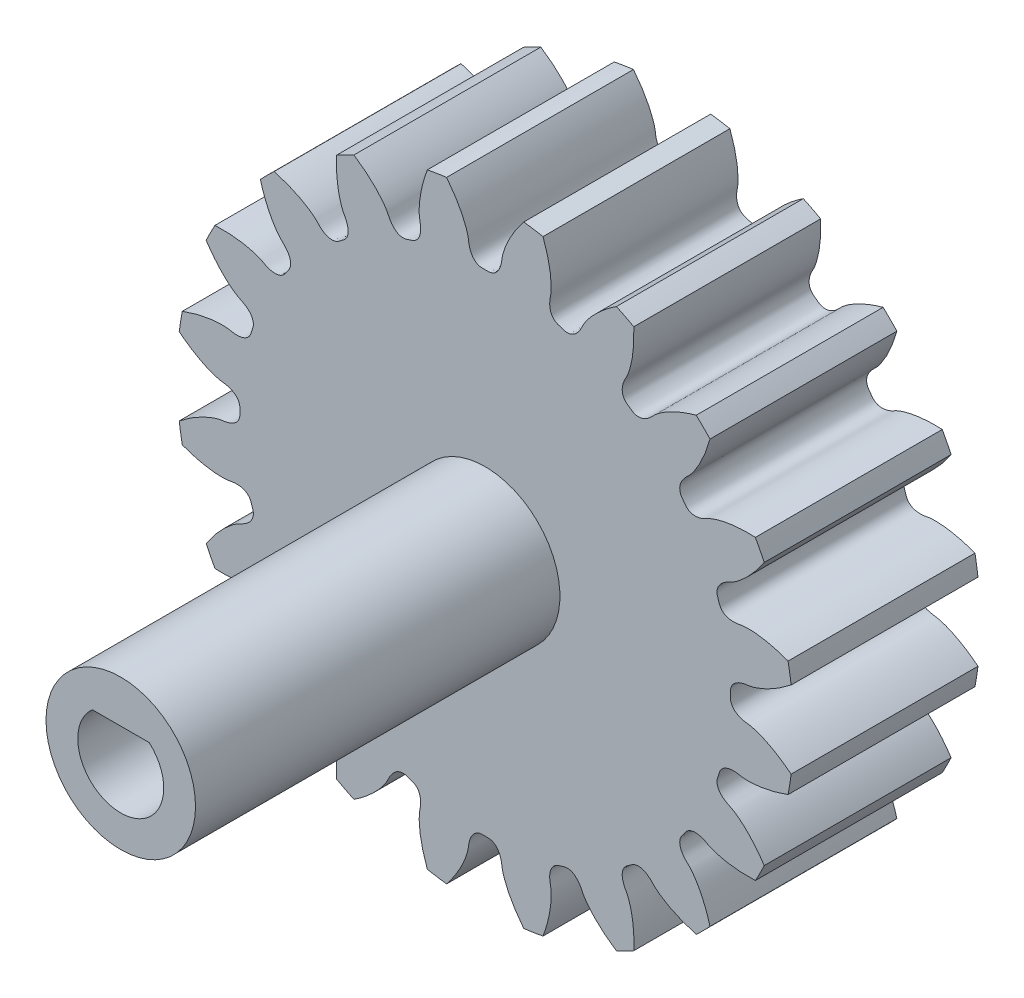
from build123d import *

# Parameters (mm, degrees)
SKETCHREVOLVESPURASSEMBLY01PINION_W       = 10
SKETCHREVOLVESPURASSEMBLY01PINION_H       = 16.499999752
TOOTHEXTRUDECUTSPURASSEMBLY01PINION_DEPTH = 5
PATTERNSPURASSEMBLY01PINION_COUNT         = 20
SKETCH1_R                                 = 4
BOSS_EXTRUDE1_DEPTH                       = 19.5
CUT_EXTRUDE5_DEPTH                        = 8
BOSS_EXTRUDE5_START                       = 5
SKETCH8_R                                 = 4
BOSS_EXTRUDE5_DEPTH                       = 5


with BuildPart() as part:
    # SketchRevolveSpurAssembly01Pinion → SpurAssembly01Pinion (revolve)
    with BuildSketch(Plane(origin=(0, 0, 0), x_dir=(0, 0, -1), z_dir=(1, 0, 0))):
        with Locations((0, 8.249999876)):
            Rectangle(SKETCHREVOLVESPURASSEMBLY01PINION_W, SKETCHREVOLVESPURASSEMBLY01PINION_H)
    revolve(axis=Axis((0, 0, 0), (0, 0, -1)))

    # SketchToothSpurAssembly01Pinion → ToothExtrudeCutSpurAssembly01Pinion (cut, symmetric)
    with BuildSketch(Plane.XY):
        with BuildLine():
            ThreePointArc((16.438815928, 2.120364973), (16.574999751, 0), (16.438815928, -2.120364973))
            add(Edge.make_bspline(
                [(16.438815928, -2.120364973), (16.306213447, -2.012632117), (16.10792267, -1.860929635), (15.841705586, -1.676668952), (15.654853966, -1.55570694), (15.475899367, -1.447553762), (15.305444286, -1.351598726), (15.144060802, -1.267206194), (14.992289617, -1.193717223), (14.850639167, -1.130450865), (14.719584807, -1.0767054), (14.599567969, -1.031760257), (14.490995634, -0.99487577), (14.394239041, -0.965299916), (14.309634999, -0.942253529), (14.237479548, -0.924980687), (14.178044201, -0.912608864), (14.049223501, -0.890261122), (13.912281496, -0.878231728), (13.769652297, -0.842658369), (13.695599357, -0.820644128), (13.624377747, -0.794966749), (13.555692175, -0.765356143), (13.489258635, -0.731124882), (13.424830796, -0.691333031), (13.362331646, -0.644635632), (13.30209452, -0.589245233), (13.24524803, -0.523019137), (13.194309632, -0.443877425), (13.153279262, -0.350864326), (13.130262908, -0.253354669), (13.120821868, -0.134969136), (13.12767395, 0), (13.120821868, 0.134969136), (13.130262908, 0.253354669), (13.153279262, 0.350864326), (13.194309632, 0.443877425), (13.24524803, 0.523019137), (13.30209452, 0.589245233), (13.362331646, 0.644635632), (13.424830796, 0.691333031), (13.489258635, 0.731124882), (13.555692175, 0.765356143), (13.624377747, 0.794966749), (13.695599357, 0.820644128), (13.769652297, 0.842658369), (13.912281496, 0.878231728), (14.049223501, 0.890261122), (14.178044201, 0.912608864), (14.237479548, 0.924980687), (14.309634999, 0.942253529), (14.394239041, 0.965299916), (14.490995634, 0.99487577), (14.599567969, 1.031760257), (14.719584807, 1.0767054), (14.850639167, 1.130450865), (14.992289617, 1.193717223), (15.144060802, 1.267206194), (15.305444286, 1.351598726), (15.475899367, 1.447553762), (15.654853966, 1.55570694), (15.841705586, 1.676668952), (16.10792267, 1.860929635), (16.306213447, 2.012632117), (16.438815928, 2.120364973)],
                knots=[0, 0, 0, 0, 0.061422842, 0.089709677, 0.116380121, 0.141434175, 0.164871838, 0.186693111, 0.206897994, 0.225486485, 0.242458587, 0.257814298, 0.271553618, 0.283676548, 0.294183087, 0.303073236, 0.310346995, 0.316004363, 0.350076802, 0.359567688, 0.36880314, 0.37784437, 0.386769007, 0.395675631, 0.404688756, 0.413962948, 0.423682731, 0.434051196, 0.445255861, 0.457401439, 0.47041984, 0.481066796, 0.5, 0.518933204, 0.52958016, 0.542598561, 0.554744139, 0.565948804, 0.576317269, 0.586037052, 0.595311244, 0.604324369, 0.613230993, 0.62215563, 0.63119686, 0.640432312, 0.649923198, 0.683995637, 0.689653005, 0.696926764, 0.705816913, 0.716323452, 0.728446382, 0.742185702, 0.757541413, 0.774513515, 0.793102006, 0.813306889, 0.835128162, 0.858565825, 0.883619879, 0.910290323, 0.938577158, 1, 1, 1, 1], degree=3))
        make_face()
    toothextrudecutspurassembly01pinion = extrude(amount=TOOTHEXTRUDECUTSPURASSEMBLY01PINION_DEPTH, both=True, mode=Mode.SUBTRACT)

    # PatternSpurAssembly01Pinion: ToothExtrudeCutSpurAssembly01Pinion ×20 about axis
    patternspurassembly01pinion_axis = Axis((0, 0, 55), (0, 0, -1))
    for i in range(1, PATTERNSPURASSEMBLY01PINION_COUNT):
        add(toothextrudecutspurassembly01pinion.rotate(patternspurassembly01pinion_axis, i * 360 / PATTERNSPURASSEMBLY01PINION_COUNT), mode=Mode.SUBTRACT)

    # Sketch1 → Boss-Extrude1 (add)
    with BuildSketch(Plane.XY.offset(5)):
        Circle(SKETCH1_R)
    extrude(amount=BOSS_EXTRUDE1_DEPTH)

    # Sketch7 → Cut-Extrude5 (cut)
    with BuildSketch(Plane.XY.offset(24.5)):
        with BuildLine():
            Line((1.521307004, 1.725), (-1.521307004, 1.725))
            ThreePointArc((-1.521307004, 1.725), (0, -2.3), (1.521307004, 1.725))
        make_face()
    extrude(amount=-CUT_EXTRUDE5_DEPTH, mode=Mode.SUBTRACT)

    # Sketch8 → Boss-Extrude5 (add)
    with BuildSketch(Plane(origin=(0, 0, -5), x_dir=(-1, 0, 0), z_dir=(0, 0, -1)).offset(BOSS_EXTRUDE5_START)):
        Circle(SKETCH8_R)
    extrude(amount=-BOSS_EXTRUDE5_DEPTH)


solid = part.part
